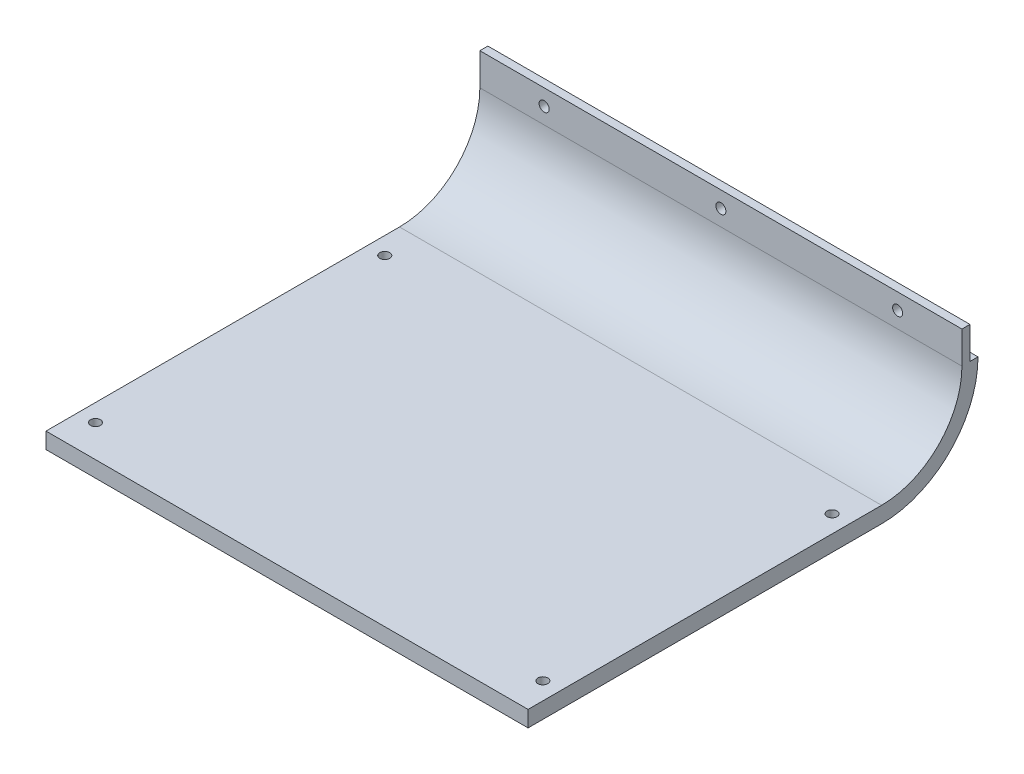
from build123d import *

# Parameters (mm, degrees)
BOSS_EXTRUDE1_DEPTH      = 190.5
BOSS_EXTRUDE1_DEPTH_BACK = 190.5
SKETCH2_W                = 381
SKETCH2_H                = 6.35
BOSS_EXTRUDE2_DEPTH      = 25.4
SKETCH3_R                = 3.96875
CUT_EXTRUDE1_DEPTH       = 25.4
SKETCH4_R                = 3.937
CUT_EXTRUDE2_DEPTH       = 302.34078715


with BuildPart() as part:
    # Sketch1 → Boss-Extrude1 (new, two sides: drawn at the far end of the back side and taken through both)
    with BuildSketch(Plane(origin=(0, 0, 0), x_dir=(0, 0, -1), z_dir=(1, 0, 0)).offset(-BOSS_EXTRUDE1_DEPTH_BACK)):
        with BuildLine():
            Line((-139.7, 0), (139.7, 0))
            ThreePointArc((139.7, 0), (193.581536726, 22.318463274), (215.9, 76.2))
            Line((215.9, 76.2), (203.2, 76.2))
            ThreePointArc((203.2, 76.2), (184.601280605, 31.298719395), (139.7, 12.7))
            Line((139.7, 12.7), (-139.7, 12.7))
            Line((-139.7, 12.7), (-139.7, 0))
        make_face()
    extrude(amount=BOSS_EXTRUDE1_DEPTH + BOSS_EXTRUDE1_DEPTH_BACK)

    # Sketch2 → Boss-Extrude2 (add)
    with BuildSketch(Plane(origin=(0, 76.2, 0), x_dir=(1, 0, 0), z_dir=(0, 1, 0))):
        with Locations((0, 206.375)):
            Rectangle(SKETCH2_W, SKETCH2_H)
    extrude(amount=BOSS_EXTRUDE2_DEPTH)

    # Sketch3 → Cut-Extrude1 (cut)
    with BuildSketch(Plane(origin=(0, 0, -209.55), x_dir=(-1, 0, 0), z_dir=(0, 0, -1))):
        with Locations((-139.7, 88.9)):
            Circle(SKETCH3_R)
        with Locations((139.7, 88.9)):
            Circle(SKETCH3_R)
        with Locations((0, 88.9)):
            Circle(SKETCH3_R)
    extrude(amount=-CUT_EXTRUDE1_DEPTH, mode=Mode.SUBTRACT)

    # Sketch4 → Cut-Extrude2 (cut, through all)
    with BuildSketch(Plane(origin=(0, 12.7, 0), x_dir=(1, 0, 0), z_dir=(0, 1, 0))):
        with Locations((176.784, -114.3)):
            Circle(SKETCH4_R)
        with Locations((176.784, 114.3)):
            Circle(SKETCH4_R)
        with Locations((-176.784, -114.3)):
            Circle(SKETCH4_R)
        with Locations((-176.784, 114.3)):
            Circle(SKETCH4_R)
    extrude(amount=-CUT_EXTRUDE2_DEPTH, mode=Mode.SUBTRACT)


solid = part.part
